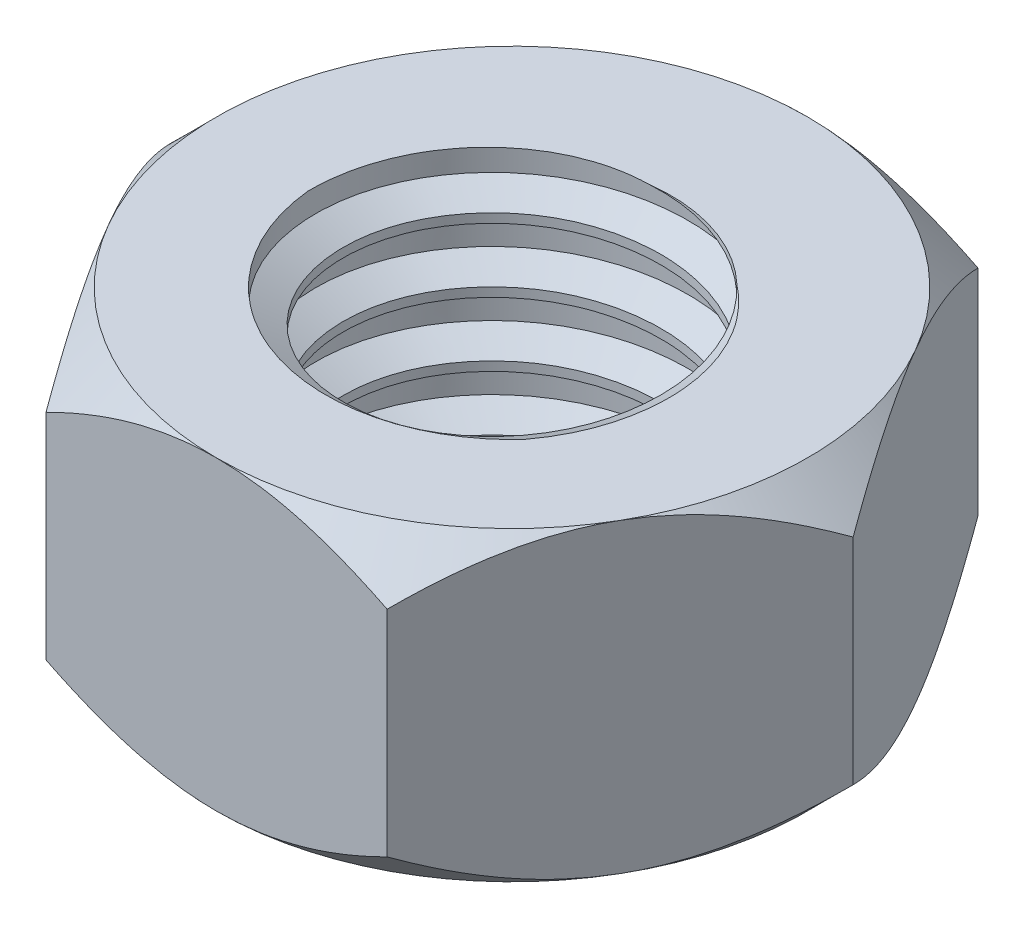
from build123d import *

# Parameters (mm, degrees)
SKETCH1_R           = 3.5
BOSS_EXTRUDE1_DEPTH = 6.731
CUT_SWEEP3_PITCH    = 1.411111111
SKETCH4_OUTSIDE_W   = 34.668
SKETCH4_OUTSIDE_H   = 32.656
SKETCH4_OUTSIDE_R   = 6.5
CUT_EXTRUDE1_DEPTH  = 6.731
CUT_EXTRUDE1_DRAFT  = -45
SKETCH5_OUTSIDE_W   = 34.668
SKETCH5_OUTSIDE_H   = 32.656
SKETCH5_OUTSIDE_R   = 6.5
CUT_EXTRUDE2_DEPTH  = 6.731
CUT_EXTRUDE2_DRAFT  = -45


with BuildPart() as part:
    # Sketch1 → Boss-Extrude1 (new body)
    with BuildSketch(Plane(origin=(0, 0, 0), x_dir=(1, 0, 0), z_dir=(0, 1, 0))):
        Polygon((7.505553499, 0), (3.75277675, 6.5), (-3.75277675, 6.5), (-7.505553499, 0), (-3.75277675, -6.5), (3.75277675, -6.5), align=None)
        with Locations(Location((0, 0, 0), (0, 0, 270))):
            Circle(SKETCH1_R, mode=Mode.SUBTRACT)
    extrude(amount=BOSS_EXTRUDE1_DEPTH)

    # Cut-Sweep3: the profile of Sketch2 profile screwed along a right-hand helix of 9.516614 turns, 8 arcs to a turn; built about Z, then put on its axis
    cut_sweep3_z = Axis((0, 0, 0), (0, 0, 1))
    cut_sweep3_corners = [(3.4997, 0, 0.000173205), (4.1, 0, -0.346410162), (4.1, 0, -0.86470095), (3.4997, 0, -1.211284316)]
    with BuildLine(mode=Mode.PRIVATE) as cut_sweep3_profile:
        Line(cut_sweep3_corners[0], cut_sweep3_corners[1])
        Line(cut_sweep3_corners[1], cut_sweep3_corners[2])
        Line(cut_sweep3_corners[2], cut_sweep3_corners[3])
        Line(cut_sweep3_corners[3], cut_sweep3_corners[0])
    cut_sweep3_cap = Face(cut_sweep3_profile.wire())
    cut_sweep3_turn_angles = [0, 22.5, 45, 67.5, 90, 112.5, 135, 157.5, 180, 202.5, 225, 247.5, 270, 292.5, 315, 337.5, 360]
    cut_sweep3_turn_weights = [1, 0.9238795325112867, 1, 0.9238795325112867, 1, 0.9238795325112867, 1, 0.9238795325112867, 1, 0.9238795325112867, 1, 0.9238795325112867, 1, 0.9238795325112867, 1, 0.9238795325112867, 1]
    cut_sweep3_turn_rails = [Edge.make_bspline([Vector(p[0], p[1], 0).rotate(cut_sweep3_z, cut_sweep3_turn_angles[k]) / cut_sweep3_turn_weights[k] + Vector(0, 0, p[2] + CUT_SWEEP3_PITCH * cut_sweep3_turn_angles[k] / 360) for k in range(17)], [0, 0, 0, 1, 1, 2, 2, 3, 3, 4, 4, 5, 5, 6, 6, 7, 7, 8, 8, 8], 2, cut_sweep3_turn_weights) for p in cut_sweep3_corners]
    cut_sweep3_turn_sides = [Face.make_surface_from_curves(cut_sweep3_turn_rails[p[0]], cut_sweep3_turn_rails[p[1]]) for p in [(0, 1), (1, 2), (2, 3), (3, 0)]]
    cut_sweep3_last_angles = [3240, 3262.5, 3285, 3307.5, 3330, 3352.5, 3375, 3397.5, 3420, 3422.990551181, 3425.981102362]
    cut_sweep3_last_weights = [1, 0.9238795325112867, 1, 0.9238795325112867, 1, 0.9238795325112867, 1, 0.9238795325112867, 1, 0.9986381520545707, 1]
    cut_sweep3_last_rails = [Edge.make_bspline([Vector(p[0], p[1], 0).rotate(cut_sweep3_z, cut_sweep3_last_angles[k]) / cut_sweep3_last_weights[k] + Vector(0, 0, p[2] + CUT_SWEEP3_PITCH * cut_sweep3_last_angles[k] / 360) for k in range(11)], [0, 0, 0, 1, 1, 2, 2, 3, 3, 4, 4, 5, 5, 5], 2, cut_sweep3_last_weights) for p in cut_sweep3_corners]
    cut_sweep3_last_sides = [Face.make_surface_from_curves(cut_sweep3_last_rails[p[0]], cut_sweep3_last_rails[p[1]]) for p in [(0, 1), (1, 2), (2, 3), (3, 0)]]
    cut_sweep3 = Plane(origin=(0, 0, 0), x_dir=(-1, 0, 0), z_dir=(0, 1, 0)) * Solid(Shell([*[p.moved(Location((0, 0, CUT_SWEEP3_PITCH * i))) for i in range(9) for p in cut_sweep3_turn_sides], *cut_sweep3_last_sides, cut_sweep3_cap, cut_sweep3_cap.rotate(cut_sweep3_z, 3425.981102362).moved(Location((0, 0, CUT_SWEEP3_PITCH * 3425.981102362 / 360)))]))
    add(cut_sweep3, mode=Mode.SUBTRACT)


with BuildPart() as cut_extrude1_tool:
    # Sketch4 outside → Cut-Extrude1 (with draft: the straight prism first)
    with BuildSketch(Plane(origin=(0, 6.731, 0), x_dir=(1, 0, 0), z_dir=(0, 1, 0))):
        Rectangle(SKETCH4_OUTSIDE_W, SKETCH4_OUTSIDE_H)
        Circle(SKETCH4_OUTSIDE_R, mode=Mode.SUBTRACT)
    extrude(amount=-CUT_EXTRUDE1_DEPTH)
    # Cut-Extrude1: the draft: its side faces are tilted about the plane it starts from
    cut_extrude1_sides = [cut_extrude1_tool.faces().sort_by_distance(p)[0] for p in [
        (0, 3.3655, 16.328),
        (17.334, 3.3655, 0),
        (0, 3.3655, -16.328),
        (-17.334, 3.3655, 0),
        (-6.5, 3.3655, 0),
    ]]
    draft(cut_extrude1_sides, Plane(origin=(0, 6.731, 0), x_dir=(1, 0, 0), z_dir=(0, 1, 0)), CUT_EXTRUDE1_DRAFT)


with BuildPart() as part_1:
    add(part.part)

    # Cut-Extrude1: cut by cut_extrude1_tool
    add(cut_extrude1_tool.part, mode=Mode.SUBTRACT)


with BuildPart() as cut_extrude2_tool:
    # Sketch5 outside → Cut-Extrude2 (with draft: the straight prism first)
    with BuildSketch(Plane.XZ):
        Rectangle(SKETCH5_OUTSIDE_W, SKETCH5_OUTSIDE_H)
        Circle(SKETCH5_OUTSIDE_R, mode=Mode.SUBTRACT)
    extrude(amount=-CUT_EXTRUDE2_DEPTH)
    # Cut-Extrude2: the draft: its side faces are tilted about the plane it starts from
    cut_extrude2_sides = [cut_extrude2_tool.faces().sort_by_distance(p)[0] for p in [
        (0, 3.3655, -16.328),
        (17.334, 3.3655, 0),
        (0, 3.3655, 16.328),
        (-17.334, 3.3655, 0),
        (-6.5, 3.3655, 0),
    ]]
    draft(cut_extrude2_sides, Plane.XZ, CUT_EXTRUDE2_DRAFT)


with BuildPart() as part_2:
    add(part_1.part)

    # Cut-Extrude2: cut by cut_extrude2_tool
    add(cut_extrude2_tool.part, mode=Mode.SUBTRACT)


solid = part_2.part
